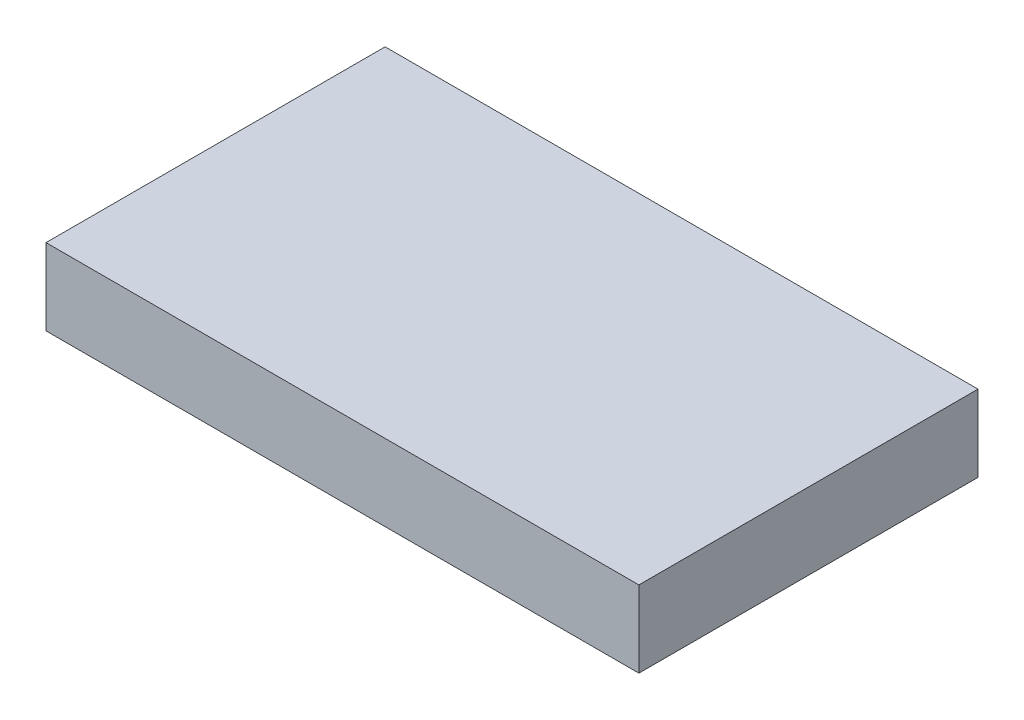
from build123d import *

# Parameters (mm, degrees)
SKETCH_1_W      = 77.56667628
SKETCH_1_H      = 44.364704145
EXTRUDE_1_DEPTH = 10


with BuildPart() as part:
    # 草图1 → 凸台-拉伸1 (new body)
    with BuildSketch(Plane(origin=(0, 0, 0), x_dir=(1, 0, 0), z_dir=(0, 1, 0))):
        with Locations((38.78333814, -22.182352073)):
            Rectangle(SKETCH_1_W, SKETCH_1_H)
    extrude(amount=EXTRUDE_1_DEPTH)


solid = part.part
